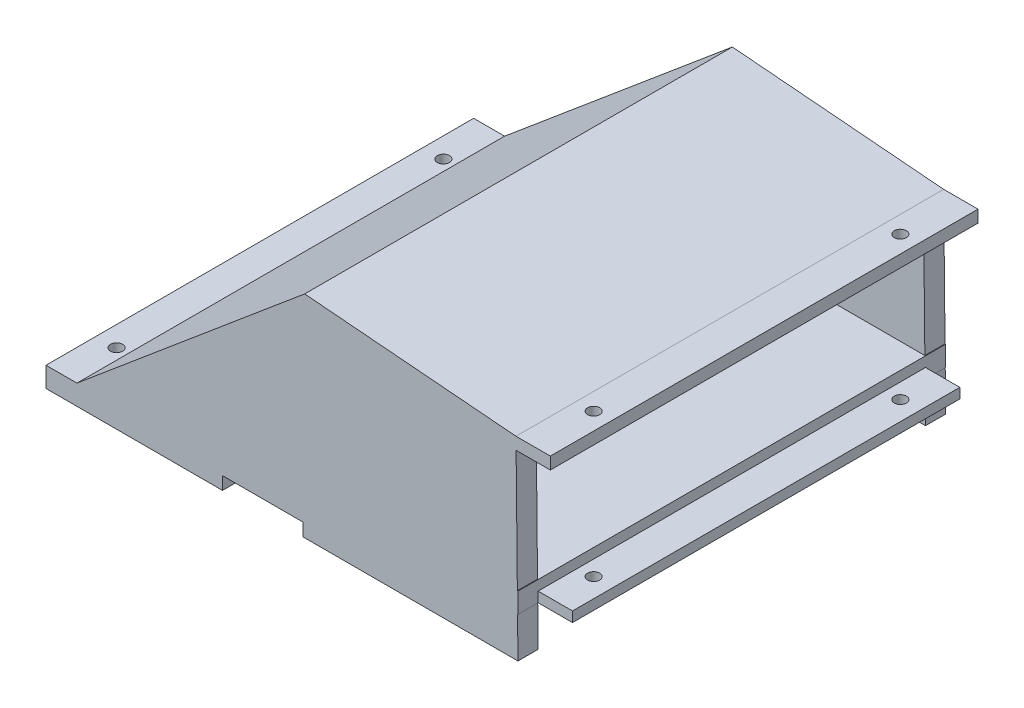
from build123d import *

# Parameters (mm, degrees)
BOSS_EXTRUDE1_DEPTH     = 212
CUT_EXTRUDE1_REACH      = 340.559
SKETCH2_W               = 17.02
SKETCH2_H               = 10
SKETCH3_R               = 1.5
CUT_EXTRUDE2_DEPTH      = 15
SKETCH4_R               = 3
CUT_EXTRUDE3_DEPTH      = 15
SKETCH5_W               = 30
SKETCH5_H               = 15
CUT_EXTRUDE4_DEPTH      = 15
CUT_EXTRUDE5_DEPTH      = 342.555266392
CUT_EXTRUDE5_DEPTH_BACK = 342.555266392
SKETCH6_R               = 3
BOSS_EXTRUDE2_DEPTH     = 10
BOSS_EXTRUDE3_DEPTH     = 10
CUT_EXTRUDE6_DEPTH      = 342.555266392
CUT_EXTRUDE6_DEPTH_BACK = 342.555266392
SKETCH9_W               = 40
SKETCH9_H               = 6.35


with BuildPart() as part:
    # Sketch1 → Boss-Extrude1 (new body)
    with BuildSketch(Plane.XY):
        Polygon((0, 0), (0, -6), (-17.02, -6), (-118.621865464, 2.463033027), (-118.621865464, -66), (-16.042509221, -66), (-16.042509221, -71), (0.977490779, -71), (0.977490779, -76), (-206.164928148, -76), (-230, -96), (-250, -96), (-250, -86), (-234.663076582, -86), (-121.773554608, 8.725556251), (-17.02, 0), align=None)
        Polygon((-138.621865464, -19.324641013), (-138.621865464, -66), (-194.247392222, -66), align=None, mode=Mode.SUBTRACT)
    extrude(amount=BOSS_EXTRUDE1_DEPTH)

    # Sketch2 → Cut-Extrude1 (cut, up to next)
    with BuildSketch(Plane.XZ.offset(76), mode=Mode.PRIVATE) as cut_extrude1_sk1:
        with Locations((-7.532509221, 207)):
            Rectangle(SKETCH2_W, SKETCH2_H)
    cut_extrude1_tool1 = extrude(cut_extrude1_sk1.sketch, amount=-CUT_EXTRUDE1_REACH, mode=Mode.PRIVATE) & part.part
    # Sketch2 → Cut-Extrude1 (cut, up to next)
    with BuildSketch(Plane.XZ.offset(76), mode=Mode.PRIVATE) as cut_extrude1_sk2:
        with Locations((-7.532509221, 5)):
            Rectangle(SKETCH2_W, SKETCH2_H)
    cut_extrude1_tool2 = extrude(cut_extrude1_sk2.sketch, amount=-CUT_EXTRUDE1_REACH, mode=Mode.PRIVATE) & part.part
    add(cut_extrude1_tool1.solids().sort_by_distance((-7.532509, -76, 207))[0], mode=Mode.SUBTRACT)
    add(cut_extrude1_tool2.solids().sort_by_distance((-7.532509, -76, 5))[0], mode=Mode.SUBTRACT)

    # Sketch3 → Cut-Extrude2 (cut)
    with BuildSketch(Plane(origin=(-118.621865464, 0, 0), x_dir=(0, 0, -1), z_dir=(1, 0, 0))):
        with Locations((-159.5, -12.536966973)):
            Circle(SKETCH3_R)
        with Locations((-159.5, -52.536966973)):
            Circle(SKETCH3_R)
        with Locations((-52.5, -52.536966973)):
            Circle(SKETCH3_R)
        with Locations((-52.5, -12.536966973)):
            Circle(SKETCH3_R)
    extrude(amount=-CUT_EXTRUDE2_DEPTH, mode=Mode.SUBTRACT)

    # Sketch4 → Cut-Extrude3 (cut)
    with BuildSketch(Plane(origin=(0, -86, 0), x_dir=(1, 0, 0), z_dir=(0, 1, 0))):
        with Locations((-240, -25)):
            Circle(SKETCH4_R)
        with Locations((-240, -187)):
            Circle(SKETCH4_R)
    extrude(amount=-CUT_EXTRUDE3_DEPTH, mode=Mode.SUBTRACT)

    # Sketch5 → Cut-Extrude4 (cut)
    with BuildSketch(Plane(origin=(0, -66, 0), x_dir=(1, 0, 0), z_dir=(0, 1, 0))):
        with Locations((-98.621865464, -184.31184426)):
            Rectangle(SKETCH5_W, SKETCH5_H)
    extrude(amount=-CUT_EXTRUDE4_DEPTH, mode=Mode.SUBTRACT)

    # Sketch6 → Cut-Extrude5 (cut, two sides: drawn at the far end of the back side and taken through both)
    with BuildSketch(Plane(origin=(0, 0, 0), x_dir=(1, 0, 0), z_dir=(0, 1, 0)).offset(-CUT_EXTRUDE5_DEPTH_BACK)):
        with Locations((-8.52, -30)):
            Circle(SKETCH6_R)
        with Locations((-8.52, -182)):
            Circle(SKETCH6_R)
    extrude(amount=CUT_EXTRUDE5_DEPTH + CUT_EXTRUDE5_DEPTH_BACK, mode=Mode.SUBTRACT)

    # Sketch7 → Boss-Extrude2 (add)
    with BuildSketch(Plane.XY.offset(212)):
        Polygon((-17.02, 0), (-121.773554608, 8.725556251), (-234.663076582, -86), (-250, -86), (-250, -96), (-16.042509221, -96), align=None)
    extrude(amount=-BOSS_EXTRUDE2_DEPTH)

    # Sketch8 → Boss-Extrude3 (add)
    with BuildSketch(Plane(origin=(0, 0, 0), x_dir=(-1, 0, 0), z_dir=(0, 0, -1))):
        Polygon((250, -96), (230, -96), (16.042509221, -96), (17.02, 0), (121.773554608, 8.725556251), (234.663076582, -86), (250, -86), align=None)
    extrude(amount=-BOSS_EXTRUDE3_DEPTH)

    # Sketch9 → Cut-Extrude6 (cut, two sides: drawn at the far end of the back side and taken through both)
    with BuildSketch(Plane.XY.offset(212).offset(-CUT_EXTRUDE6_DEPTH_BACK)):
        with Locations((-142.5, -92.825)):
            Rectangle(SKETCH9_W, SKETCH9_H)
    extrude(amount=CUT_EXTRUDE6_DEPTH + CUT_EXTRUDE6_DEPTH_BACK, mode=Mode.SUBTRACT)


solid = part.part
